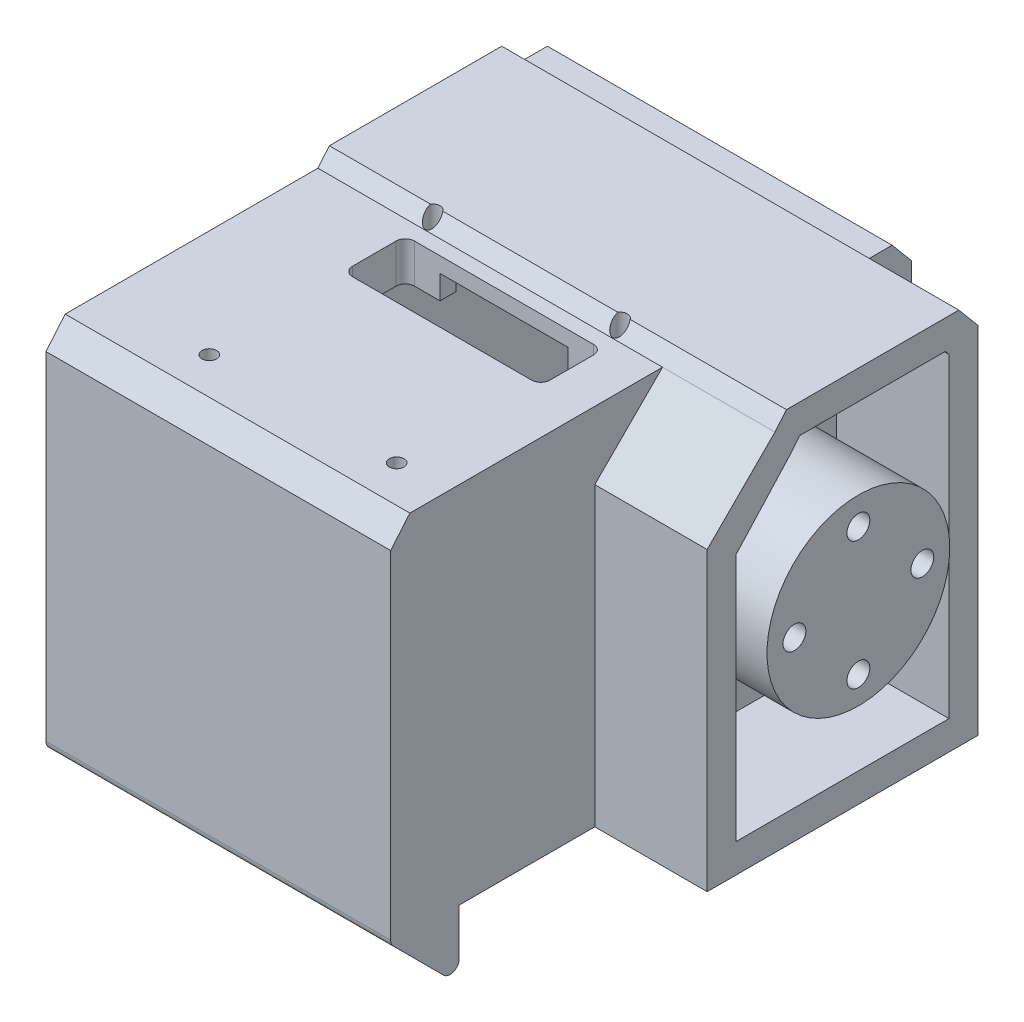
from build123d import *
from OCP.BRepFilletAPI import BRepFilletAPI_MakeChamfer
from build123d.topology import SkipClean

# Parameters (mm, degrees)
SKETCH1_W            = 51.97
SKETCH1_H            = 43.25
BOSS_EXTRUDE1_DEPTH  = 3.175
SKETCH2_W            = 51.97
SKETCH2_H            = 43.25
SKETCH2_W_2          = 45.62
SKETCH2_H_2          = 36.9
BOSS_EXTRUDE2_DEPTH  = 25.12
SKETCH5_R            = 0.8
BOSS_EXTRUDE4_DEPTH  = 2.6
CUT_EXTRUDE2_DEPTH   = 56.514258304
FILLET4_R            = 1
SKETCH7_W            = 28.295
SKETCH7_H            = 29.75
CUT_EXTRUDE3_DEPTH   = 1.5
CHAMFER3_SIZE2       = 1.5
CHAMFER3_SIZE        = 1.258649447
CHAMFER4_SIZE        = 2.5
CHAMFER4_SIZE2       = 2.097749078
CHAMFER5_SIZE        = 2.5
CHAMFER5_SIZE2       = 2.097749078
BOSS_EXTRUDE5_START  = 1.9
SKETCH8_R            = 0.8
BOSS_EXTRUDE5_DEPTH  = 1.9
SKETCH9_R            = 0.8
CUT_EXTRUDE4_DEPTH   = 56.514258304
SKETCH10_W           = 28.295
SKETCH10_H           = 32.92
CUT_EXTRUDE5_DEPTH   = 1.9
CHAMFER6_SIZE2       = 1.594289299
CHAMFER6_SIZE        = 1.9
CUT_EXTRUDE6_DEPTH   = 56.514258304
SKETCH12_R           = 0.8
CUT_EXTRUDE7_DEPTH   = 56.514258304
SKETCH13_W           = 28.295
SKETCH13_H           = 33.009615074
CUT_EXTRUDE8_DEPTH   = 1.9
BOSS_EXTRUDE6_DEPTH  = 3.175
SKETCH15_R           = 10
SKETCH15_R_2         = 1.25
BOSS_EXTRUDE7_DEPTH  = 12.7
CUT_EXTRUDE9_START   = -3.175
SKETCH16_R           = 1.25
CUT_EXTRUDE9_DEPTH   = 3.175
BOSS_EXTRUDE8_DEPTH  = 12.3
BOSS_EXTRUDE9_DEPTH  = 6.25
SKETCH19_W           = 5
SKETCH19_H           = 38.85
BOSS_EXTRUDE10_DEPTH = 37.72
CHAMFER7_SIZE        = 2.5
CHAMFER7_SIZE2       = 2.097749078
BOSS_EXTRUDE11_DEPTH = 1
CHAMFER8_SIZE        = 1
CHAMFER8_SIZE_2      = 0.839099631
CUT_EXTRUDE10_DEPTH  = 67.093795095
CHAMFER9_SIZE        = 6.35
BOSS_EXTRUDE12_DEPTH = 37.72
FILLET5_R            = 1
FILLET6_R            = 1


with BuildPart() as part:
    # Sketch1 → Boss-Extrude1 (new body)
    with BuildSketch(Plane(origin=(0, 0, 0), x_dir=(0, 0, -1), z_dir=(1, 0, 0))):
        Rectangle(SKETCH1_W, SKETCH1_H)
    extrude(amount=BOSS_EXTRUDE1_DEPTH)

    # Sketch2 → Boss-Extrude2 (add)
    with BuildSketch(Plane(origin=(3.175, 0, 0), x_dir=(0, 0, -1), z_dir=(1, 0, 0))):
        Rectangle(SKETCH2_W, SKETCH2_H)
        Rectangle(SKETCH2_W_2, SKETCH2_H_2, mode=Mode.SUBTRACT)
    extrude(amount=BOSS_EXTRUDE2_DEPTH)

    # Sketch5 → Boss-Extrude4 (add)
    with BuildSketch(Plane.XZ.offset(-18.45)):
        with BuildLine():
            Line((6.028516065, -6.938519702), (3.175, -6.938519702))
            Line((3.175, -6.938519702), (3.175, 22.81))
            Line((3.175, 22.81), (28.295, 22.81))
            Line((28.295, 22.81), (28.295, -6.938516819))
            Line((28.295, -6.938516819), (25.441479797, -6.938516819))
            ThreePointArc((25.441479797, -6.938516819), (24.224057136, -5.304544733), (22.734996312, -3.913616778))
            Line((22.734996312, -3.913616778), (22.734999457, -2.150000068))
            Line((22.734999457, -2.150000068), (26.535, -2.149999996))
            Line((26.535, -2.149999996), (26.535, 4.625))
            Line((26.535, 4.625), (25.038042913, 4.625))
            Line((25.038042913, 4.625), (25.177286694, 4.847898808))
            Line((25.177286694, 4.847898808), (25.177286694, 15.803085322))
            ThreePointArc((25.177286694, 15.803085322), (24.825814832, 16.651613459), (23.977286696, 17.003085322))
            Line((23.977286696, 17.003085322), (7.492713306, 17.003085322))
            ThreePointArc((7.492713306, 17.003085322), (6.64418517, 16.651613461), (6.292713306, 15.803085325))
            Line((6.292713306, 15.803085325), (6.292713306, 4.847898808))
            Line((6.292713306, 4.847898808), (6.431957087, 4.625))
            Line((6.431957087, 4.625), (4.935, 4.625))
            Line((4.935, 4.625), (4.935, -2.149999996))
            Line((4.935, -2.149999996), (8.73500054, -2.150000068))
            Line((8.73500054, -2.150000068), (8.735003672, -3.913614235))
            ThreePointArc((8.735003672, -3.913614235), (7.245940337, -5.304544533), (6.028516065, -6.938519702))
        make_face()
        with Locations(Location((5.485, -4.6, 0), (0, 0, 270))):
            Circle(SKETCH5_R, mode=Mode.SUBTRACT)
        with Locations(Location((5.485, 19.85, 0), (0, 0, 270))):
            Circle(SKETCH5_R, mode=Mode.SUBTRACT)
        with Locations(Location((25.985, 19.85, 0), (0, 0, 270))):
            Circle(SKETCH5_R, mode=Mode.SUBTRACT)
        with Locations(Location((25.985, -4.6, 0), (0, 0, 270))):
            Circle(SKETCH5_R, mode=Mode.SUBTRACT)
    extrude(amount=BOSS_EXTRUDE4_DEPTH)

    # Sketch6 → Cut-Extrude2 (cut, through all)
    with BuildSketch(Plane.XZ.offset(-18.45)):
        Polygon((6.431957087, 4.625), (4.935, 4.625), (4.935, -2.149999996), (8.73500054, -2.149999996), (22.734999457, -2.149999996), (26.535, -2.149999996), (26.535, 4.625), (25.038042913, 4.625), align=None)
    extrude(amount=-CUT_EXTRUDE2_DEPTH, mode=Mode.SUBTRACT)

    # Fillet4
    fillet4_edges = [part.edges().sort_by_distance(p)[0] for p in [
        (4.935, 20.0375, -2.149999996),
        (4.935, 18.7375, 4.625),
        (26.535, 18.7375, 4.625),
        (26.535, 20.0375, -2.149999996),
    ]]
    fillet(fillet4_edges, radius=FILLET4_R)

    # Sketch7 → Cut-Extrude3 (cut)
    with BuildSketch(Plane(origin=(0, 21.625, 0), x_dir=(1, 0, 0), z_dir=(0, 1, 0))):
        with Locations((14.1475, -11.11)):
            Rectangle(SKETCH7_W, SKETCH7_H)
    extrude(amount=-CUT_EXTRUDE3_DEPTH, mode=Mode.SUBTRACT)

    # Chamfer3
    chamfer3_edges = [part.edges().sort_by_distance(p)[0] for p in [
        (14.1475, 21.625, -3.765),
    ]]
    chamfer3_side = [part.faces().sort_by_distance(p)[0] for p in [
        (14.1475, 21.625, -3.790172989),
    ]]
    chamfer(chamfer3_edges, length=CHAMFER3_SIZE - 0.0001, length2=CHAMFER3_SIZE2 - 0.0001, reference=chamfer3_side[0])  # a hair under: the kernel refuses the full size

    # Chamfer4
    chamfer4_edges = [part.edges().sort_by_distance(p)[0] for p in [
        (14.1475, 20.125, 25.985),
    ]]
    chamfer4_side = [part.faces().sort_by_distance(p)[0] for p in [
        (14.1475, -0.75, 25.985),
    ]]
    chamfer(chamfer4_edges, length=CHAMFER4_SIZE, length2=CHAMFER4_SIZE2, reference=chamfer4_side[0])

    # Chamfer5
    chamfer5_edges = [part.edges().sort_by_distance(p)[0] for p in [
        (14.1475, 21.625, -25.985),
    ]]
    chamfer5_side = [part.faces().sort_by_distance(p)[0] for p in [
        (14.1475, 0, -25.985),
    ]]
    chamfer(chamfer5_edges, length=CHAMFER5_SIZE, length2=CHAMFER5_SIZE2, reference=chamfer5_side[0])

    # Sketch8 → Boss-Extrude5 (add)
    # profile 1 of 2: a face of its own
    with BuildSketch(Plane(origin=(0, -18.45, 0), x_dir=(1, 0, 0), z_dir=(0, 1, 0)).offset(BOSS_EXTRUDE5_START)):
        with BuildLine():
            Line((8.535, -21.20621931), (8.535, 2.277382622))
            ThreePointArc((8.535, 2.277382622), (8.678721463, 2.846834684), (9.07545942, 3.279882607))
            ThreePointArc((9.07545942, 3.279882607), (7.174247423, 4.924433894), (5.668201654, 6.937139072))
            ThreePointArc((5.668201654, 6.937139072), (5.667144466, 6.93892423), (5.666087595, 6.940709575))
            Line((5.666087595, 6.940709575), (3.175, 6.940709575))
            Line((3.175, 6.940709575), (3.175, -22.81))
            Line((3.175, -22.81), (8.815822102, -22.81))
            Line((8.815822102, -22.81), (8.815822102, -21.97765433))
            ThreePointArc((8.815822102, -21.97765433), (8.607388924, -21.616698616), (8.535, -21.20621931))
        make_face()
        with Locations(Location((5.485, -16.1, 0), (0, 0, 90))):
            Circle(SKETCH8_R, mode=Mode.SUBTRACT)
        with Locations(Location((5.485, 4.6, 0), (0, 0, 90))):
            Circle(SKETCH8_R, mode=Mode.SUBTRACT)
    # profile 2 of 2: a face of its own
    with BuildSketch(Plane(origin=(0, -18.45, 0), x_dir=(1, 0, 0), z_dir=(0, 1, 0)).offset(BOSS_EXTRUDE5_START)):
        with BuildLine():
            Line((22.654192711, -21.977637856), (22.654192711, -22.81))
            Line((22.654192711, -22.81), (28.295, -22.81))
            Line((28.295, -22.81), (28.295, 6.939158699))
            Line((28.295, 6.939158699), (25.802994691, 6.939158699))
            ThreePointArc((25.802994691, 6.939158699), (24.296552833, 4.925292532), (22.394540839, 3.279882437))
            ThreePointArc((22.394540839, 3.279882437), (22.791278611, 2.846834547), (22.935, 2.27738262))
            Line((22.935, 2.27738262), (22.935000265, -21.206220073))
            ThreePointArc((22.935000265, -21.206220073), (22.862615212, -21.616688792), (22.654192711, -21.977637856))
        make_face()
        with Locations(Location((25.985, -16.1, 0), (0, 0, 90))):
            Circle(SKETCH8_R, mode=Mode.SUBTRACT)
        with Locations(Location((25.985, 4.6, 0), (0, 0, 90))):
            Circle(SKETCH8_R, mode=Mode.SUBTRACT)
    extrude(amount=-BOSS_EXTRUDE5_DEPTH)

    # Sketch9 → Cut-Extrude4 (cut, through all)
    with SkipClean():  # the faces are left unmerged after this step: merging them gives an invalid solid
        with BuildSketch(Plane.XZ.offset(-18.45)):
            with Locations(Location((5.485, -4.6, 0), (0, 0, 211.975852771))):
                Circle(SKETCH9_R)
            with Locations(Location((25.985, -4.6, 0), (0, 0, 211.975852771))):
                Circle(SKETCH9_R)
            with Locations(Location((25.985, 19.85, 0), (0, 0, 90))):
                Circle(SKETCH9_R)
            with Locations(Location((5.485, 19.85, 0), (0, 0, 90))):
                Circle(SKETCH9_R)
        extrude(amount=-CUT_EXTRUDE4_DEPTH, mode=Mode.SUBTRACT)
    add(part.part.scale(1), mode=Mode.REPLACE)  # the faces are merged on a copy

    # Sketch10 → Cut-Extrude5 (cut)
    with BuildSketch(Plane.XZ.offset(21.625)):
        with Locations((14.1475, 9.525)):
            Rectangle(SKETCH10_W, SKETCH10_H)
    extrude(amount=-CUT_EXTRUDE5_DEPTH, mode=Mode.SUBTRACT)

    # Chamfer6
    chamfer6_edges = [part.edges().sort_by_distance(p)[0] for p in [
        (14.1475, -19.725, -6.935),
    ]]
    chamfer6_side = [part.faces().sort_by_distance(p)[0] for p in [
        (14.1475, -19.756885786, -6.935),
    ]]
    chamfer(chamfer6_edges, length=CHAMFER6_SIZE - 0.0001, length2=CHAMFER6_SIZE2 - 0.0001, reference=chamfer6_side[0])  # a hair under: the kernel refuses the full size

    # Sketch11 → Cut-Extrude6 (cut, through all)
    with BuildSketch(Plane(origin=(0, -18.45, 0), x_dir=(1, 0, 0), z_dir=(0, 1, 0))):
        with BuildLine():
            Line((3.175, 22.81), (3.175, 6.940709575))
            Line((3.175, 6.940709575), (5.666087595, 6.940709575))
            ThreePointArc((5.666087595, 6.940709575), (7.172833315, 4.925952029), (9.07545942, 3.279882607))
            ThreePointArc((9.07545942, 3.279882607), (15.735000094, 0.521410441), (22.394540839, 3.279882437))
            ThreePointArc((22.394540839, 3.279882437), (24.296552833, 4.925292532), (25.802994691, 6.939158699))
            Line((25.802994691, 6.939158699), (28.295, 6.939158699))
            Line((28.295, 6.939158699), (28.295, 22.81))
            Line((28.295, 22.81), (3.175, 22.81))
        make_face()
    extrude(amount=-CUT_EXTRUDE6_DEPTH, mode=Mode.SUBTRACT)

    # Sketch12 → Cut-Extrude7 (cut, through all)
    with BuildSketch(Plane(origin=(0, -18.45, 0), x_dir=(1, 0, 0), z_dir=(0, 1, 0))):
        with Locations(Location((25.985, 4.6, 0), (0, 0, 148.024147229))):
            Circle(SKETCH12_R)
        with Locations(Location((25.985, -16.1, 0), (0, 0, 90))):
            Circle(SKETCH12_R)
        with Locations(Location((5.485, -16.1, 0), (0, 0, 90))):
            Circle(SKETCH12_R)
        with Locations(Location((5.485, 4.6, 0), (0, 0, 148.024147229))):
            Circle(SKETCH12_R)
    extrude(amount=-CUT_EXTRUDE7_DEPTH, mode=Mode.SUBTRACT)

    # Sketch13 → Cut-Extrude8 (cut)
    with BuildSketch(Plane.XZ.offset(21.625)):
        with Locations((14.1475, -9.480192463)):
            Rectangle(SKETCH13_W, SKETCH13_H)
    extrude(amount=-CUT_EXTRUDE8_DEPTH, mode=Mode.SUBTRACT)

    # Sketch14 → Boss-Extrude6 (add)
    with BuildSketch(Plane(origin=(28.295, 0, 0), x_dir=(0, 0, -1), z_dir=(1, 0, 0))):
        Polygon((25.985, -19.725), (25.985, 19.125), (23.887250922, 21.625), (5.023649447, 21.625), (3.765, 20.125), (-23.887250922, 20.125), (-25.985, 17.625), (-25.985, -19.725), align=None)
    extrude(amount=BOSS_EXTRUDE6_DEPTH)

    # Sketch15 → Boss-Extrude7 (add)
    with BuildSketch(Plane(origin=(31.47, 0, 0), x_dir=(0, 0, -1), z_dir=(1, 0, 0))):
        with Locations((12.495, 0)):
            Circle(SKETCH15_R)
        with Locations((12.495, 7)):
            Circle(SKETCH15_R_2, mode=Mode.SUBTRACT)
        with Locations((19.495, 0)):
            Circle(SKETCH15_R_2, mode=Mode.SUBTRACT)
        with Locations((5.495, 0)):
            Circle(SKETCH15_R_2, mode=Mode.SUBTRACT)
        with Locations((12.495, -7)):
            Circle(SKETCH15_R_2, mode=Mode.SUBTRACT)
    extrude(amount=BOSS_EXTRUDE7_DEPTH)

    # Sketch16 → Cut-Extrude9 (cut)
    with BuildSketch(Plane(origin=(31.47, 0, 0), x_dir=(0, 0, -1), z_dir=(1, 0, 0)).offset(CUT_EXTRUDE9_START)):
        with Locations((19.495, 0)):
            Circle(SKETCH16_R)
        with Locations((12.495, -7)):
            Circle(SKETCH16_R)
        with Locations((5.495, 0)):
            Circle(SKETCH16_R)
        with Locations((12.495, 7)):
            Circle(SKETCH16_R)
    extrude(amount=CUT_EXTRUDE9_DEPTH, mode=Mode.SUBTRACT)

    # Sketch17 → Boss-Extrude8 (add)
    with BuildSketch(Plane(origin=(31.47, 0, 0), x_dir=(0, 0, -1), z_dir=(1, 0, 0))):
        Polygon((25.985, -19.725), (25.985, 19.125), (23.887250922, 21.625), (5.023649447, 21.625), (3.765, 20.125), (-3.652691279, 12.707308721), (-3.652691279, 11.672370782), (-3.652691279, -16.55), (-3.652691279, -19.725), align=None)
        Polygon((-0.477691279, -16.55), (22.81, -16.55), (22.81, 17.969394506), (22.406724107, 18.45), (6.504176261, 18.45), (5.245526815, 16.95), (-0.477691279, 10.665513175), align=None, mode=Mode.SUBTRACT)
    extrude(amount=BOSS_EXTRUDE8_DEPTH)

    # Sketch18 → Boss-Extrude9 (add)
    with BuildSketch(Plane.ZY):
        Polygon((-25.985, 19.125), (-25.985, -19.725), (25.985, -19.725), (25.985, 17.625), (23.887250922, 20.125), (-3.765, 20.125), (-5.023649447, 21.625), (-23.887250922, 21.625), align=None)
    extrude(amount=BOSS_EXTRUDE9_DEPTH)

    # Sketch19 → Boss-Extrude10 (add)
    with BuildSketch(Plane.ZY.offset(6.25)):
        with Locations((-28.485, -0.3)):
            Rectangle(SKETCH19_W, SKETCH19_H)
    extrude(amount=-BOSS_EXTRUDE10_DEPTH)

    # Chamfer7
    chamfer7_edges = [part.edges().sort_by_distance(p)[0] for p in [
        (12.61, 19.125, -30.985),
    ]]
    chamfer7_side = [part.faces().sort_by_distance(p)[0] for p in [
        (12.61, -0.3, -30.985),
    ]]
    chamfer(chamfer7_edges, length=CHAMFER7_SIZE, length2=CHAMFER7_SIZE2, reference=chamfer7_side[0])

    # Sketch20 → Boss-Extrude11 (add)
    with BuildSketch(Plane.ZY.offset(6.25)):
        with BuildLine():
            Line((-25.985, 14.125), (-25.985, -12.225))
            ThreePointArc((-25.985, -12.225), (-25.252766953, -13.992766953), (-23.485, -14.725))
            Line((-23.485, -14.725), (18.485, -14.725))
            ThreePointArc((18.485, -14.725), (20.252766953, -13.992766953), (20.985, -12.225))
            Line((20.985, -12.225), (20.985, 12.625))
            ThreePointArc((20.985, 12.625), (20.252766953, 14.392766953), (18.485, 15.125))
            Line((18.485, 15.125), (-6.096538291, 15.125))
            Line((-6.096538291, 15.125), (-7.355187738, 16.625))
            Line((-7.355187738, 16.625), (-21.555712631, 16.625))
            Line((-21.555712631, 16.625), (-23.653461709, 14.125))
            Line((-23.653461709, 14.125), (-25.985, 14.125))
        make_face()
    extrude(amount=BOSS_EXTRUDE11_DEPTH)

    # Chamfer8
    chamfer8_edges_1 = [part.edges().sort_by_distance(p)[0] for p in [
        (-7.25, 0.95, -25.985),
    ]]
    chamfer8_side_1 = [part.faces().sort_by_distance(p)[0] for p in [
        (-7.233218007, 0.95, -25.985),
    ]]
    chamfer8_edges_2 = [part.edges().sort_by_distance(p)[0] for p in [
        (-7.25, 14.125, -24.819230855),
    ]]
    chamfer8_side_2 = [part.faces().sort_by_distance(p)[0] for p in [
        (-7.233218007, 14.125, -24.819230855),
    ]]
    chamfer8_edges_3 = [part.edges().sort_by_distance(p)[0] for p in [
        (-7.25, 15.375, -22.60458717),
    ]]
    chamfer8_side_3 = [part.faces().sort_by_distance(p)[0] for p in [
        (-7.233218007, 15.375, -22.60458717),
    ]]
    chamfer8_edges_4 = [part.edges().sort_by_distance(p)[0] for p in [
        (-7.25, 16.625, -14.455450184),
    ]]
    chamfer8_side_4 = [part.faces().sort_by_distance(p)[0] for p in [
        (-7.233218007, 16.625, -14.455450184),
    ]]
    chamfer8_edges_5 = [part.edges().sort_by_distance(p)[0] for p in [
        (-7.25, 15.875, -6.725863014),
    ]]
    chamfer8_side_5 = [part.faces().sort_by_distance(p)[0] for p in [
        (-7.233218007, 15.875, -6.725863014),
    ]]
    chamfer8_edges_6 = [part.edges().sort_by_distance(p)[0] for p in [
        (-7.25, 15.125, 6.194230855),
    ]]
    chamfer8_side_6 = [part.faces().sort_by_distance(p)[0] for p in [
        (-7.233218007, 15.125, 6.194230855),
    ]]
    chamfer8_edges_7 = [part.edges().sort_by_distance(p)[0] for p in [
        (-7.25, 14.392766953, 20.252766953),
    ]]
    chamfer8_side_7 = [part.faces().sort_by_distance(p)[0] for p in [
        (-7.233218007, 14.392766953, 20.252766953),
    ]]
    chamfer8_edges_8 = [part.edges().sort_by_distance(p)[0] for p in [
        (-7.25, 0.2, 20.985),
    ]]
    chamfer8_side_8 = [part.faces().sort_by_distance(p)[0] for p in [
        (-7.233218007, 0.2, 20.985),
    ]]
    chamfer8_edges_9 = [part.edges().sort_by_distance(p)[0] for p in [
        (-7.25, -13.992766953, 20.252766953),
    ]]
    chamfer8_side_9 = [part.faces().sort_by_distance(p)[0] for p in [
        (-7.233218007, -13.992766953, 20.252766953),
    ]]
    chamfer8_edges_10 = [part.edges().sort_by_distance(p)[0] for p in [
        (-7.25, -14.725, -2.5),
    ]]
    chamfer8_side_10 = [part.faces().sort_by_distance(p)[0] for p in [
        (-7.233218007, -14.725, -2.5),
    ]]
    chamfer8_edges_11 = [part.edges().sort_by_distance(p)[0] for p in [
        (-7.25, -13.992766953, -25.252766953),
    ]]
    chamfer8_side_11 = [part.faces().sort_by_distance(p)[0] for p in [
        (-7.233218007, -13.992766953, -25.252766953),
    ]]
    chamfer8 = BRepFilletAPI_MakeChamfer(part.part.solid().wrapped)
    for e in chamfer8_edges_1:
        chamfer8.Add(CHAMFER8_SIZE - 0.0001, CHAMFER8_SIZE_2 - 0.0001, e.wrapped, chamfer8_side_1[0].wrapped)
    for e in chamfer8_edges_2:
        chamfer8.Add(CHAMFER8_SIZE - 0.0001, CHAMFER8_SIZE_2 - 0.0001, e.wrapped, chamfer8_side_2[0].wrapped)
    for e in chamfer8_edges_3:
        chamfer8.Add(CHAMFER8_SIZE - 0.0001, CHAMFER8_SIZE_2 - 0.0001, e.wrapped, chamfer8_side_3[0].wrapped)
    for e in chamfer8_edges_4:
        chamfer8.Add(CHAMFER8_SIZE - 0.0001, CHAMFER8_SIZE_2 - 0.0001, e.wrapped, chamfer8_side_4[0].wrapped)
    for e in chamfer8_edges_5:
        chamfer8.Add(CHAMFER8_SIZE - 0.0001, CHAMFER8_SIZE_2 - 0.0001, e.wrapped, chamfer8_side_5[0].wrapped)
    for e in chamfer8_edges_6:
        chamfer8.Add(CHAMFER8_SIZE - 0.0001, CHAMFER8_SIZE_2 - 0.0001, e.wrapped, chamfer8_side_6[0].wrapped)
    for e in chamfer8_edges_7:
        chamfer8.Add(CHAMFER8_SIZE - 0.0001, CHAMFER8_SIZE_2 - 0.0001, e.wrapped, chamfer8_side_7[0].wrapped)
    for e in chamfer8_edges_8:
        chamfer8.Add(CHAMFER8_SIZE - 0.0001, CHAMFER8_SIZE_2 - 0.0001, e.wrapped, chamfer8_side_8[0].wrapped)
    for e in chamfer8_edges_9:
        chamfer8.Add(CHAMFER8_SIZE - 0.0001, CHAMFER8_SIZE_2 - 0.0001, e.wrapped, chamfer8_side_9[0].wrapped)
    for e in chamfer8_edges_10:
        chamfer8.Add(CHAMFER8_SIZE - 0.0001, CHAMFER8_SIZE_2 - 0.0001, e.wrapped, chamfer8_side_10[0].wrapped)
    for e in chamfer8_edges_11:
        chamfer8.Add(CHAMFER8_SIZE - 0.0001, CHAMFER8_SIZE_2 - 0.0001, e.wrapped, chamfer8_side_11[0].wrapped)
    add(Compound.cast(chamfer8.Shape()), mode=Mode.REPLACE)  # a hair under: the kernel refuses the full size

    # Sketch21 → Cut-Extrude10 (cut, through all)
    with BuildSketch(Plane(origin=(0, -16.55, 0), x_dir=(1, 0, 0), z_dir=(0, 1, 0))):
        with BuildLine():
            Line((3.175, -7.934645212), (28.295, -7.935420651))
            Line((28.295, -7.935420651), (28.295, 6.939158699))
            Line((28.295, 6.939158699), (25.802994691, 6.939158699))
            ThreePointArc((25.802994691, 6.939158699), (24.296552833, 4.925292532), (22.394540839, 3.279882437))
            ThreePointArc((22.394540839, 3.279882437), (15.735000094, 0.521410441), (9.07545942, 3.279882607))
            ThreePointArc((9.07545942, 3.279882607), (7.172833315, 4.925952029), (5.666087595, 6.940709575))
            Line((5.666087595, 6.940709575), (3.175, 6.940709575))
            Line((3.175, 6.940709575), (3.175, -7.934645212))
        make_face()
    extrude(amount=-CUT_EXTRUDE10_DEPTH, mode=Mode.SUBTRACT)

    # Chamfer9
    chamfer9_edges = [part.edges().sort_by_distance(p)[0] for p in [
        (15.735, -19.725, -22.81),
    ]]
    chamfer(chamfer9_edges, length=CHAMFER9_SIZE)

    # Sketch22 → Boss-Extrude12 (add)
    with BuildSketch(Plane(origin=(31.47, 0, 0), x_dir=(0, 0, -1), z_dir=(1, 0, 0))):
        Polygon((-25.985, -19.725), (-18.485, -27.225), (-18.485, -19.725), align=None)
    extrude(amount=-BOSS_EXTRUDE12_DEPTH)

    # Fillet5
    fillet5_edges = [part.edges().sort_by_distance(p)[0] for p in [
        (12.61, -19.725, 25.985),
        (12.61, -19.725, -30.985),
    ]]
    fillet(fillet5_edges, radius=FILLET5_R)

    # Fillet6
    fillet6_edges = [part.edges().sort_by_distance(p)[0] for p in [
        (12.61, -27.225, 18.485),
    ]]
    fillet(fillet6_edges, radius=FILLET6_R)


solid = part.part
